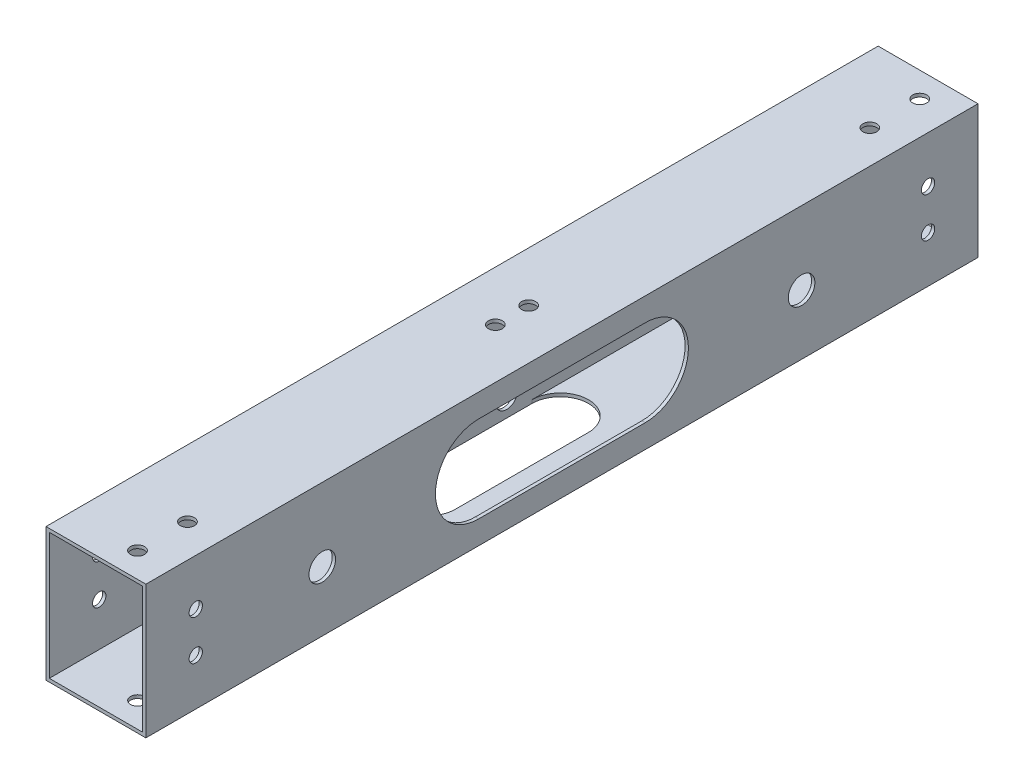
from build123d import *

# Parameters (mm, degrees)
SKETCH_1_W          = 30
SKETCH_1_H          = 40
SKETCH_1_W_2        = 28
SKETCH_1_H_2        = 38
EXTRUDE_1_DEPTH     = 250
SKETCH_3_R          = 2.1
CUT_EXTRUDE_1_DEPTH = 250
SKETCH_4_R          = 4
CUT_EXTRUDE_2_DEPTH = 250
SKETCH_5_R          = 7
CUT_EXTRUDE_3_DEPTH = 250
CUT_EXTRUDE_4_DEPTH = 20
CUT_EXTRUDE_6_DEPTH = 22
SKETCH_8_R          = 3.25
CUT_EXTRUDE_7_DEPTH = 22
SKETCH_9_R          = 2
CUT_EXTRUDE_8_DEPTH = 36


with BuildPart() as part:
    # 草图1 → 凸台-拉伸1 (new body)
    with BuildSketch(Plane.XY):
        Rectangle(SKETCH_1_W, SKETCH_1_H)
        Rectangle(SKETCH_1_W_2, SKETCH_1_H_2, mode=Mode.SUBTRACT)
    extrude(amount=EXTRUDE_1_DEPTH)

    # 草图3 → 切除-拉伸1 (cut)
    with BuildSketch(Plane(origin=(0, 20, 0), x_dir=(1, 0, 0), z_dir=(0, 1, 0))):
        with Locations((5, -7.5)):
            Circle(SKETCH_3_R)
        with Locations((5, -22.5)):
            Circle(SKETCH_3_R)
        with Locations((5, -227.5)):
            Circle(SKETCH_3_R)
        with Locations((5, -242.5)):
            Circle(SKETCH_3_R)
        with Locations((0, -120)):
            Circle(SKETCH_3_R)
        with Locations((0, -130)):
            Circle(SKETCH_3_R)
    extrude(amount=-CUT_EXTRUDE_1_DEPTH, mode=Mode.SUBTRACT)

    # 草图4 → 切除-拉伸2 (cut)
    with BuildSketch(Plane(origin=(15, 0, 0), x_dir=(0, 0, -1), z_dir=(1, 0, 0))):
        with Locations((-53, -2)):
            Circle(SKETCH_4_R)
        with Locations((-197, -2)):
            Circle(SKETCH_4_R)
    extrude(amount=-CUT_EXTRUDE_2_DEPTH, mode=Mode.SUBTRACT)

    # 草图5 → 切除-拉伸3 (cut)
    with BuildSketch(Plane.ZY.offset(15)):
        with Locations((125, -2)):
            Circle(SKETCH_5_R)
    extrude(amount=-CUT_EXTRUDE_3_DEPTH, mode=Mode.SUBTRACT)

    # 草图6 → 切除-拉伸4 (cut)
    with BuildSketch(Plane.XZ.offset(20)):
        with BuildLine():
            Line((-14, 145), (-14, 105))
            ThreePointArc((-14, 105), (-5.5, 96.5), (3, 105))
            Line((3, 105), (3, 145))
            ThreePointArc((3, 145), (-5.5, 153.5), (-14, 145))
        make_face()
    extrude(amount=-CUT_EXTRUDE_4_DEPTH, mode=Mode.SUBTRACT)

    # 草图7 → 切除-拉伸6 (cut)
    with BuildSketch(Plane(origin=(15, 0, 0), x_dir=(0, 0, -1), z_dir=(1, 0, 0))):
        with BuildLine():
            Line((-150, 13), (-100, 13))
            ThreePointArc((-100, 13), (-87, 0), (-100, -13))
            Line((-100, -13), (-150, -13))
            ThreePointArc((-150, -13), (-163, 0), (-150, 13))
        make_face()
    extrude(amount=-CUT_EXTRUDE_6_DEPTH, mode=Mode.SUBTRACT)

    # 草图8 → 切除-拉伸7 (cut)
    with BuildSketch(Plane.ZY.offset(15)):
        with Locations((112.625, -14.5)):
            Circle(SKETCH_8_R)
        with Locations((137.375, -14.5)):
            Circle(SKETCH_8_R)
        with Locations((112.625, 10.25)):
            Circle(SKETCH_8_R)
        with Locations((137.375, 10.25)):
            Circle(SKETCH_8_R)
    extrude(amount=-CUT_EXTRUDE_7_DEPTH, mode=Mode.SUBTRACT)

    # 草图9 → 切除-拉伸8 (cut)
    with BuildSketch(Plane(origin=(15, 0, 0), x_dir=(0, 0, -1), z_dir=(1, 0, 0))):
        with Locations((-15, 6)):
            Circle(SKETCH_9_R)
        with Locations((-15, -6)):
            Circle(SKETCH_9_R)
        with Locations((-235, -6)):
            Circle(SKETCH_9_R)
        with Locations((-235, 6)):
            Circle(SKETCH_9_R)
    extrude(amount=-CUT_EXTRUDE_8_DEPTH, mode=Mode.SUBTRACT)


solid = part.part
